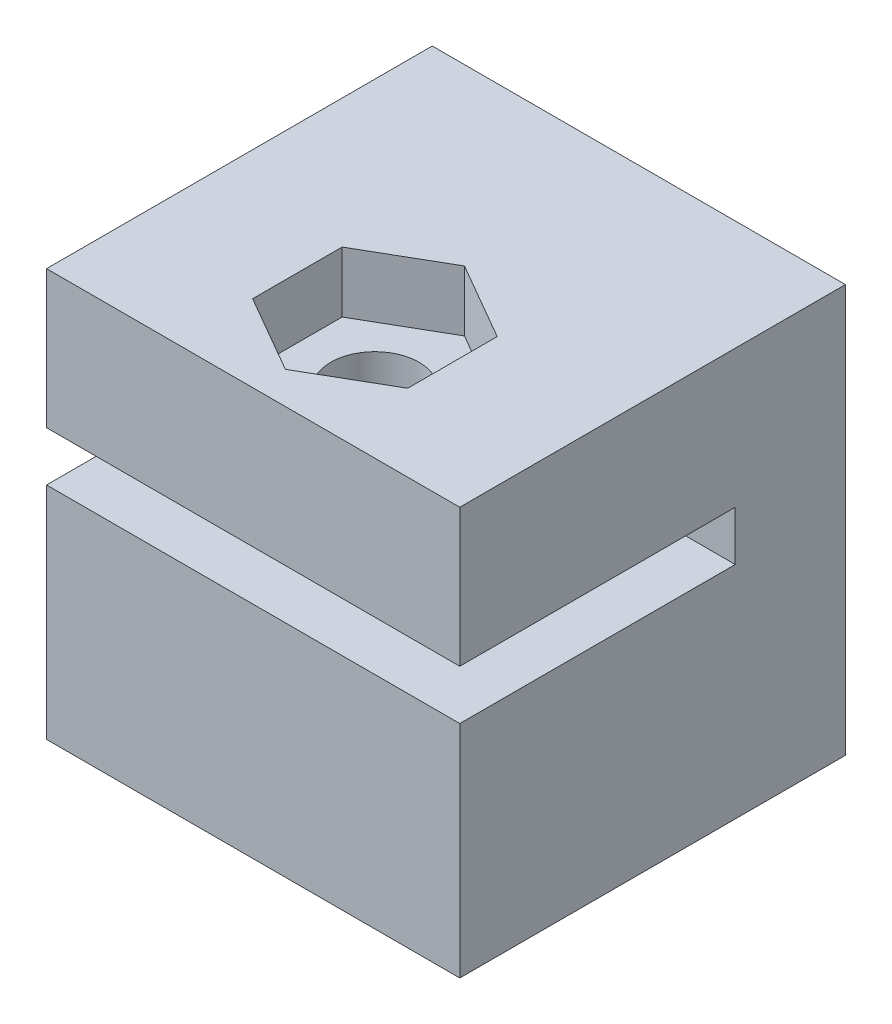
from build123d import *

# Parameters (mm, degrees)
SKETCH1_W    = 15
SKETCH1_H    = 14
BASE_DEPTH   = 8
SKETCH3_W    = 15
SKETCH3_H    = 4
SPACER_DEPTH = 1.8
SKETCH4_W    = 15
SKETCH4_H    = 14
TOP_DEPTH    = 5
BORE_DEPTH   = 19.008053754
NUT_DEPTH    = 2.2


with BuildPart() as part:
    # Sketch1 → base (new body)
    with BuildSketch(Plane(origin=(0, 0, 0), x_dir=(1, 0, 0), z_dir=(0, 1, 0))):
        Rectangle(SKETCH1_W, SKETCH1_H)
    extrude(amount=BASE_DEPTH)

    # Sketch3 → spacer (add)
    with BuildSketch(Plane(origin=(0, 8, 0), x_dir=(1, 0, 0), z_dir=(0, 1, 0))):
        with Locations((0, 5)):
            Rectangle(SKETCH3_W, SKETCH3_H)
    extrude(amount=SPACER_DEPTH)

    # Sketch4 → top (add)
    with BuildSketch(Plane(origin=(0, 9.8, 0), x_dir=(1, 0, 0), z_dir=(0, 1, 0))):
        Rectangle(SKETCH4_W, SKETCH4_H)
    extrude(amount=TOP_DEPTH)

    # Sketch5 → bore (cut, through all)
    with BuildSketch(Plane(origin=(0, 14.8, 0), x_dir=(1, 0, 0), z_dir=(0, 1, 0))):
        with BuildLine():
            ThreePointArc((1.6, -2.58), (1.13137085, -1.44862915), (0, -0.98))
            ThreePointArc((0, -0.98), (-1.13137085, -3.71137085), (1.6, -2.58))
        make_face()
    extrude(amount=-BORE_DEPTH, mode=Mode.SUBTRACT)

    # Sketch6 → nut (cut)
    with BuildSketch(Plane(origin=(0, 14.8, 0), x_dir=(1, 0, 0), z_dir=(0, 1, 0))):
        Polygon((0, 0.67), (-2.814582562, -0.955), (-2.814582562, -4.205), (0, -5.83), (2.814582562, -4.205), (2.814582562, -0.955), align=None)
    extrude(amount=-NUT_DEPTH, mode=Mode.SUBTRACT)


solid = part.part
